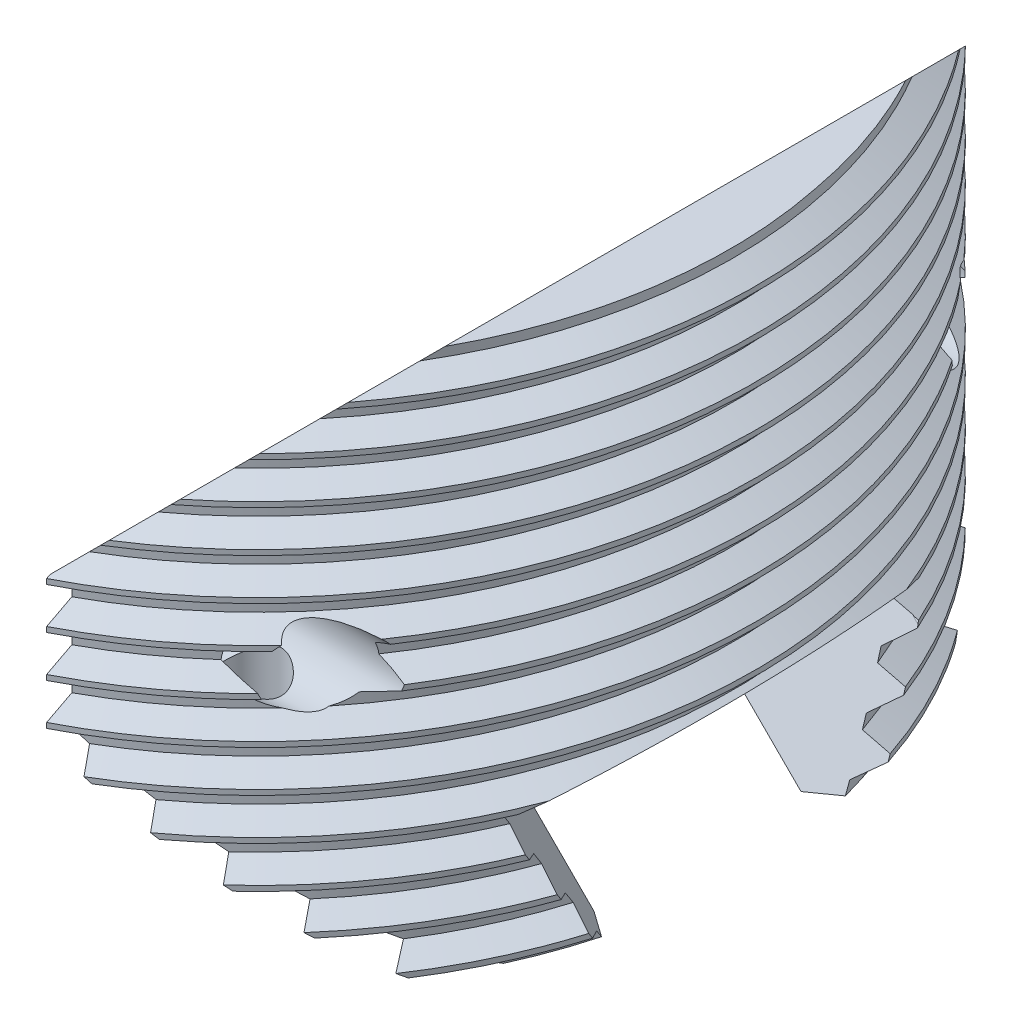
from build123d import *

# Parameters (mm, degrees)
SKETCH1_R                   = 25
BOSS_EXTRUDE1_DEPTH         = 28
THREAD1_PITCH               = 2.116666667
CUT_EXTRUDE1_DEPTH          = 47.86683315
CUT_EXTRUDE1_DEPTH_BACK     = 47.86683315
CUT_EXTRUDE2_DEPTH          = 28
CUT_EXTRUDE2_TAPER          = -30
TAP_DRILL_FOR_M5X0_8_TAP2_D = 4.2
CUT_EXTRUDE3_DEPTH          = 44.737856023
CUT_EXTRUDE3_DEPTH_BACK     = 44.737856023
SKETCH28_R                  = 1.5


with BuildPart() as part:
    # Sketch1 → Boss-Extrude1 (new body)
    with BuildSketch(Plane(origin=(0, 0, 0), x_dir=(1, 0, 0), z_dir=(0, 1, 0))):
        with Locations(Location((0, 0, 0), (0, 0, 270))):
            Circle(SKETCH1_R)
    extrude(amount=BOSS_EXTRUDE1_DEPTH)

    # Thread1: the profile of Thread Profile1 profile screwed along a right-hand helix of 15.590551 turns, 10 arcs to a turn; built about Z, then put on its axis
    thread1_z = Axis((0, 0, 0), (0, 0, 1))
    thread1_corners = [(25.0003, 0, -0.000173205), (25.0003, 0, 1.852256533), (23.854320565, 0, 1.190624997), (23.854320565, 0, 0.66145833)]
    with BuildLine(mode=Mode.PRIVATE) as thread1_profile:
        Line(thread1_corners[0], thread1_corners[1])
        Line(thread1_corners[1], thread1_corners[2])
        Line(thread1_corners[2], thread1_corners[3])
        Line(thread1_corners[3], thread1_corners[0])
    thread1_cap = Face(thread1_profile.wire())
    thread1_turn_angles = [0, 18, 36, 54, 72, 90, 108, 126, 144, 162, 180, 198, 216, 234, 252, 270, 288, 306, 324, 342, 360]
    thread1_turn_weights = [1, 0.9510565162951535, 1, 0.9510565162951535, 1, 0.9510565162951535, 1, 0.9510565162951535, 1, 0.9510565162951535, 1, 0.9510565162951535, 1, 0.9510565162951535, 1, 0.9510565162951535, 1, 0.9510565162951535, 1, 0.9510565162951535, 1]
    thread1_turn_rails = [Edge.make_bspline([Vector(p[0], p[1], 0).rotate(thread1_z, thread1_turn_angles[k]) / thread1_turn_weights[k] + Vector(0, 0, p[2] + THREAD1_PITCH * thread1_turn_angles[k] / 360) for k in range(21)], [0, 0, 0, 1, 1, 2, 2, 3, 3, 4, 4, 5, 5, 6, 6, 7, 7, 8, 8, 9, 9, 10, 10, 10], 2, thread1_turn_weights) for p in thread1_corners]
    thread1_turn_sides = [Face.make_surface_from_curves(thread1_turn_rails[p[0]], thread1_turn_rails[p[1]]) for p in [(0, 1), (1, 2), (2, 3), (3, 0)]]
    thread1_last_angles = [5400, 5418, 5436, 5454, 5472, 5490, 5508, 5526, 5544, 5562, 5580, 5596.299212598, 5612.598425197]
    thread1_last_weights = [1, 0.9510565162951535, 1, 0.9510565162951535, 1, 0.9510565162951535, 1, 0.9510565162951535, 1, 0.9510565162951535, 1, 0.9598091490169673, 1]
    thread1_last_rails = [Edge.make_bspline([Vector(p[0], p[1], 0).rotate(thread1_z, thread1_last_angles[k]) / thread1_last_weights[k] + Vector(0, 0, p[2] + THREAD1_PITCH * thread1_last_angles[k] / 360) for k in range(13)], [0, 0, 0, 1, 1, 2, 2, 3, 3, 4, 4, 5, 5, 6, 6, 6], 2, thread1_last_weights) for p in thread1_corners]
    thread1_last_sides = [Face.make_surface_from_curves(thread1_last_rails[p[0]], thread1_last_rails[p[1]]) for p in [(0, 1), (1, 2), (2, 3), (3, 0)]]
    thread1 = Plane(origin=(0, -5, 0), x_dir=(1, 0, 0), z_dir=(0, 1, 0)) * Solid(Shell([*[p.moved(Location((0, 0, THREAD1_PITCH * i))) for i in range(15) for p in thread1_turn_sides], *thread1_last_sides, thread1_cap, thread1_cap.rotate(thread1_z, 5612.598425197).moved(Location((0, 0, THREAD1_PITCH * 5612.598425197 / 360)))]))
    add(thread1, mode=Mode.SUBTRACT)

    # SurfaceCut1
    split(bisect_by=Plane(origin=(11, 0, 0), x_dir=(0, 0, -1), z_dir=(1, 0, 0)), keep=Keep.TOP)

    # SurfaceCut2
    split(bisect_by=Plane(origin=(10.853553391, 10.853553391, 0), x_dir=(0, 0, -1), z_dir=(0.7071067811865464, 0.7071067811865488, 0)), keep=Keep.TOP)

    # SurfaceCut3
    split(bisect_by=Plane(origin=(-3.5, 3.5, 0), x_dir=(0, 0, 1), z_dir=(0.7071067811865464, -0.7071067811865488, 0)), keep=Keep.TOP)

    # Sketch7 → Cut-Extrude1 (cut, two sides: drawn at the far end of the back side and taken through both)
    with BuildSketch(Plane(origin=(10.5, -10.5, 0), x_dir=(0, 0, -1), z_dir=(0.7071067811865464, -0.7071067811865488, 0)).offset(-CUT_EXTRUDE1_DEPTH_BACK)):
        Polygon((0, 14.849242405), (4.775, 14.849242405), (10.078300859, 20.152543264), (0, 20.152543264), (-10.078300859, 20.152543264), (-4.775, 14.849242405), align=None)
    extrude(amount=CUT_EXTRUDE1_DEPTH + CUT_EXTRUDE1_DEPTH_BACK, mode=Mode.SUBTRACT)

    # Sketch8 → Cut-Extrude2 (cut)
    with BuildSketch(Plane(origin=(21.661382407, -0.126800529, -0.178664239), x_dir=(0.00824223881496715, -0.0009448174842200194, 0.9999655858174514), z_dir=(-0.9999488554797862, 0.005853460375612711, 0.00824763155682153))):
        Polygon((5.453733623, 0.131955631), (10.251176177, 6.850579788), (-9.906250352, 6.996822458), (-4.562128359, 0.204620978), align=None)
    extrude(amount=-CUT_EXTRUDE2_DEPTH, taper=CUT_EXTRUDE2_TAPER, mode=Mode.SUBTRACT)

    # Tap Drill for M5x0.8 Tap2 (through all)
    with Locations(Plane.ZY.offset(-11)):
        with Locations((-16, 14.353553391), (16, 14.353553391)):
            Hole(TAP_DRILL_FOR_M5X0_8_TAP2_D / 2)

    # Sketch28 → Cut-Extrude3 (cut, two sides: drawn at the far end of the back side and taken through both)
    with BuildSketch(Plane(origin=(0, 28, 0), x_dir=(1, 0, 0), z_dir=(0, 1, 0)).offset(-CUT_EXTRUDE3_DEPTH_BACK)):
        with Locations(Location((15, 16, 0), (0, 0, 270))):
            Circle(SKETCH28_R)
        with Locations(Location((15, -16, 0), (0, 0, 270))):
            Circle(SKETCH28_R)
    extrude(amount=CUT_EXTRUDE3_DEPTH + CUT_EXTRUDE3_DEPTH_BACK, mode=Mode.SUBTRACT)


solid = part.part
